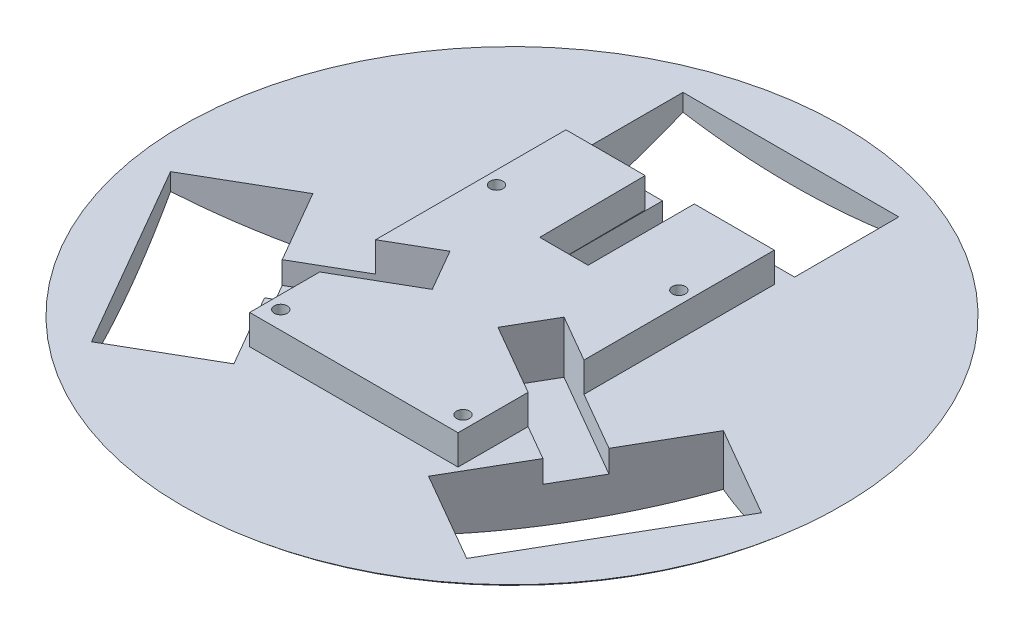
from build123d import *

# Parameters (mm, degrees)
SKETCH2_W           = 58
SKETCH2_H           = 28
CUT_EXTRUDE1_DEPTH  = 40
SKETCH4_W           = 13
SKETCH4_H           = 33
CUT_EXTRUDE2_DEPTH  = 6
SKETCH5_R           = 1.75
BOSS_EXTRUDE1_DEPTH = 8


with BuildPart() as part:
    # Sketch3 → Revolve1 (revolve)
    with BuildSketch(Plane(origin=(0, 0, 0), x_dir=(0, 0, -1), z_dir=(1, 0, 0))):
        with BuildLine():
            Line((0, 20), (0, 0))
            ThreePointArc((0, 0), (43.440585665, 3.508757487), (84.753971762, 17.38679738))
            ThreePointArc((84.753971762, 17.38679738), (86.762776598, 18.545504508), (88.56897203, 20))
            Line((88.56897203, 20), (0, 20))
        make_face()
    revolve(axis=Axis((0, 20, 0), (0, -1, 0)))

    # Sketch2 → Cut-Extrude1 (cut)
    with BuildSketch(Plane(origin=(0, 0, 0), x_dir=(1, 0, 0), z_dir=(0, 1, 0))):
        with Locations((0, 60.949465814)):
            Rectangle(SKETCH2_W, SKETCH2_H)
        Polygon((79.408141395, -12.359996197), (50.408141395, -62.589469617), (26.159430089, -48.589469617), (55.159430089, 1.640003803), align=None)
        Polygon((-50.408141395, -62.589469617), (-79.408141395, -12.359996197), (-55.159430089, 1.640003803), (-26.159430089, -48.589469617), align=None)
    extrude(amount=CUT_EXTRUDE1_DEPTH, mode=Mode.SUBTRACT)

    # Sketch4 → Cut-Extrude2 (cut)
    with BuildSketch(Plane(origin=(0, 20, 0), x_dir=(1, 0, 0), z_dir=(0, 1, 0))):
        with Locations((0, 30.449465814)):
            Rectangle(SKETCH4_W, SKETCH4_H)
        Polygon((37.409430089, -29.103898031), (43.909430089, -17.845567782), (15.330591764, -1.345567782), (8.830591764, -12.603898031), align=None)
        Polygon((-43.909430089, -17.845567782), (-37.409430089, -29.103898031), (-8.830591764, -12.603898031), (-15.330591764, -1.345567782), align=None)
    extrude(amount=-CUT_EXTRUDE2_DEPTH, mode=Mode.SUBTRACT)

    # Sketch5 → Boss-Extrude1 (add)
    with BuildSketch(Plane(origin=(0, 20, 0), x_dir=(1, 0, 0), z_dir=(0, 1, 0))):
        Polygon((-28, -23.671361037), (-8.830591764, -12.603898031), (-15.330591764, -1.345567782), (-28, -8.660254038), (-28, 42.5), (-6.711328351, 42.5), (-6.5, 13.949465814), (6.5, 13.949465814), (6.5, 42.5), (28, 42.5), (28, -8.660254038), (15.330591764, -1.345567782), (8.830591764, -12.603898031), (28, -23.671361037), (28, -42.5), (-28, -42.5), align=None)
        with Locations((-24.5, -37.660254038)):
            Circle(SKETCH5_R, mode=Mode.SUBTRACT)
        with Locations((24.5, -37.660254038)):
            Circle(SKETCH5_R, mode=Mode.SUBTRACT)
        with Locations((24.5, 20.339745962)):
            Circle(SKETCH5_R, mode=Mode.SUBTRACT)
        with Locations((-24.5, 20.339745962)):
            Circle(SKETCH5_R, mode=Mode.SUBTRACT)
    extrude(amount=BOSS_EXTRUDE1_DEPTH)


solid = part.part
